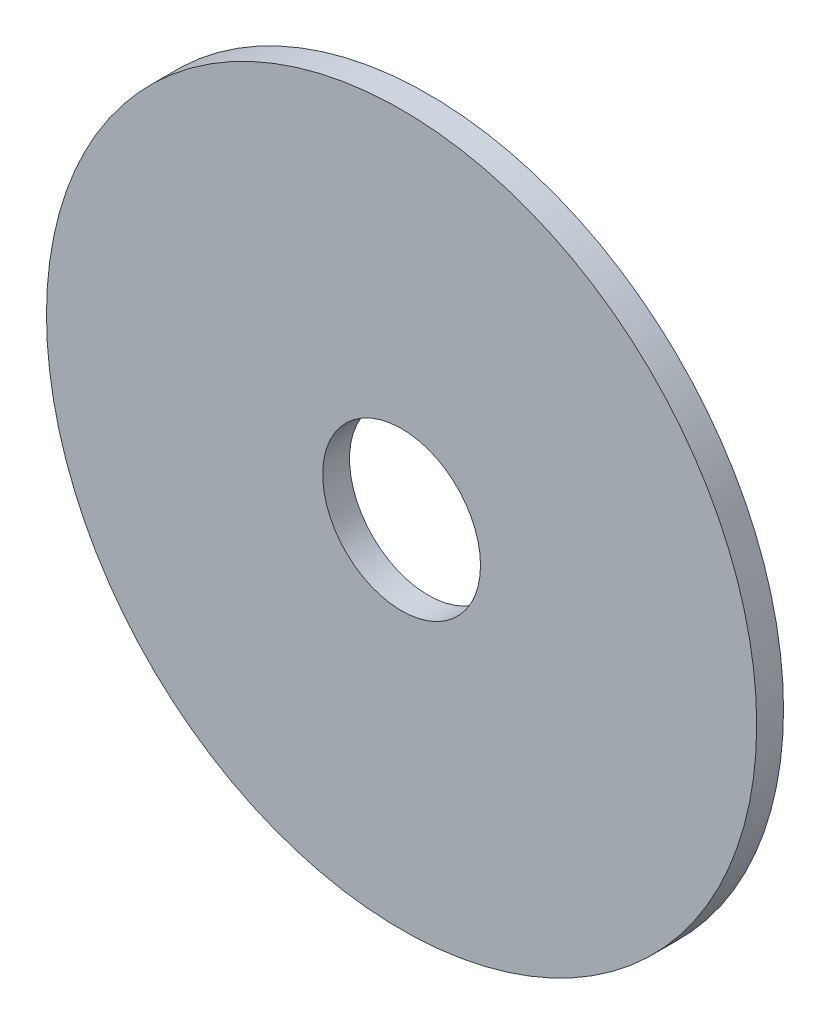
from build123d import *

# Parameters (mm, degrees)
SKETCH1_R           = 22.5
SKETCH1_R_2         = 5
BOSS_EXTRUDE1_DEPTH = 1.7


with BuildPart() as part:
    # Sketch1 → Boss-Extrude1 (new body)
    with BuildSketch(Plane.XY):
        Circle(SKETCH1_R)
        Circle(SKETCH1_R_2, mode=Mode.SUBTRACT)
    extrude(amount=BOSS_EXTRUDE1_DEPTH)


solid = part.part
